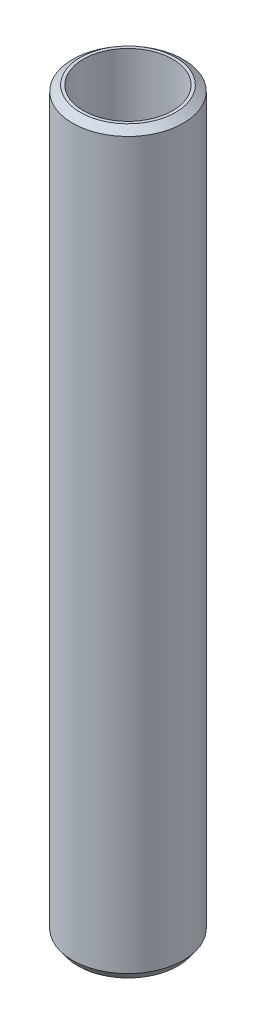
from build123d import *
from OCP.BRepFilletAPI import BRepFilletAPI_MakeChamfer

# Parameters (mm, degrees)
SKETCH1_R           = 45
BOSS_EXTRUDE1_DEPTH = 600
SKETCH2_R           = 36.320786968
CUT_EXTRUDE1_DEPTH  = 604.365560834
CHAMFER1_SIZE       = 4.486726352
CHAMFER1_SIZE2      = 6.266252712


with BuildPart() as part:
    # Sketch1 → Boss-Extrude1 (new body)
    with BuildSketch(Plane(origin=(0, 0, 0), x_dir=(1, 0, 0), z_dir=(0, 1, 0))):
        Circle(SKETCH1_R)
    extrude(amount=BOSS_EXTRUDE1_DEPTH)

    # Sketch2 → Cut-Extrude1 (cut, through all)
    with BuildSketch(Plane(origin=(0, 0, 0), x_dir=(1, 0, 0), z_dir=(0, 1, 0))):
        Circle(SKETCH2_R)
    extrude(amount=CUT_EXTRUDE1_DEPTH, mode=Mode.SUBTRACT)

    # Chamfer1: one chamfer whose edges measure the first distance from different faces: ONE call of the kernel's chamfer builder (chamfer() names one face for all edges)
    chamfer1_edges_1 = [part.edges().sort_by_distance(p)[0] for p in [
        (-45, 600, 0),
    ]]
    chamfer1_side_1 = [part.faces().sort_by_distance(p)[0] for p in [
        (-45, 300, 0),
    ]]
    chamfer1_edges_2 = [part.edges().sort_by_distance(p)[0] for p in [
        (-45, 0, 0),
    ]]
    chamfer1_side_2 = [part.faces().sort_by_distance(p)[0] for p in [
        (-43.727207794, 0, 0),
    ]]
    chamfer1 = BRepFilletAPI_MakeChamfer(part.part.solid().wrapped)
    for e in chamfer1_edges_1:
        chamfer1.Add(CHAMFER1_SIZE, CHAMFER1_SIZE2, e.wrapped, chamfer1_side_1[0].wrapped)  # the first distance lies on this face
    for e in chamfer1_edges_2:
        chamfer1.Add(CHAMFER1_SIZE, CHAMFER1_SIZE2, e.wrapped, chamfer1_side_2[0].wrapped)  # the first distance lies on this face
    add(Compound.cast(chamfer1.Shape()), mode=Mode.REPLACE)


solid = part.part
